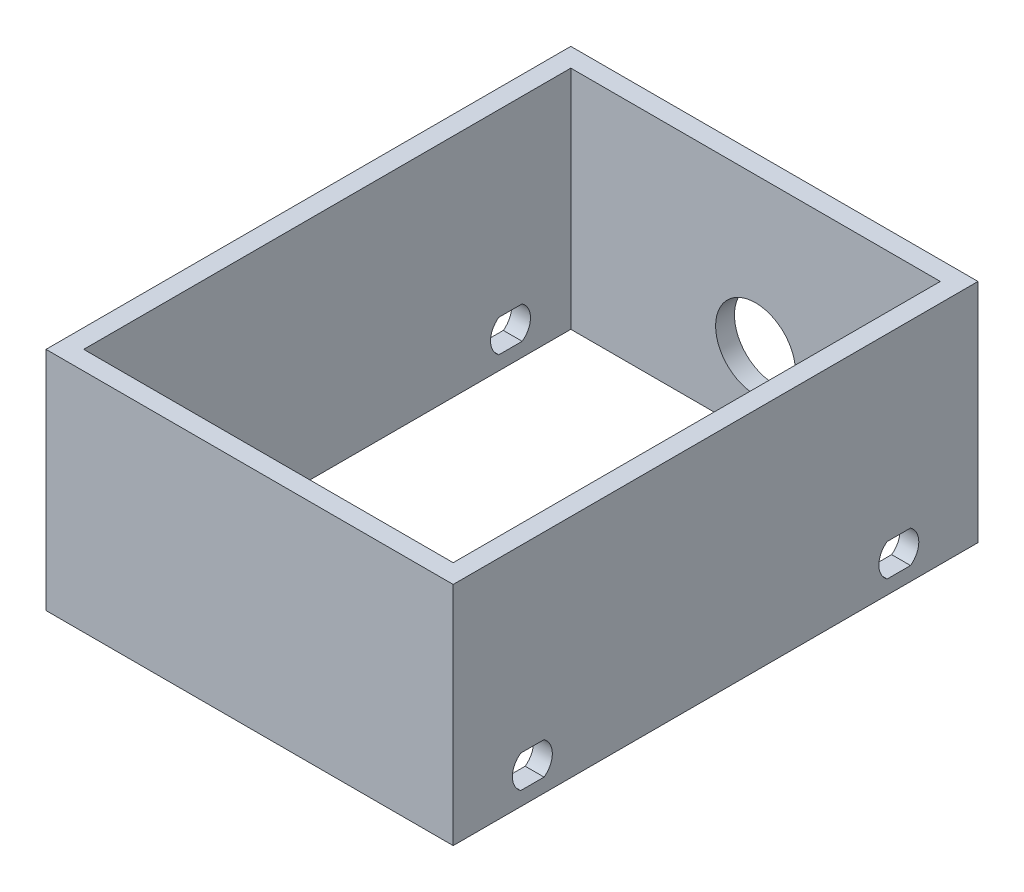
from build123d import *

# Parameters (mm, degrees)
BOSS_EXTRUDE1_DEPTH = 20
LOFT1_START         = -34.8
LOFT1_DEPTH         = 69.6
LOFT1_START_2       = -28
LOFT1_2_DEPTH       = 56
BOSS_EXTRUDE2_START = -2
BOSS_EXTRUDE2_DEPTH = 50
BOSS_EXTRUDE3_DEPTH = 2.3
BOSS_EXTRUDE4_DEPTH = 2.3
SKETCH9_W           = 56.929943861
SKETCH9_H           = 73.17042397
BOSS_EXTRUDE5_DEPTH = 34
SKETCH10_W          = 54
SKETCH10_H          = 69.6
SKETCH10_W_2        = 50
SKETCH10_H_2        = 65.6
BOSS_EXTRUDE6_DEPTH = 10
SKETCH11_W          = 50
SKETCH11_H          = 65.6
SKETCH11_W_2        = 49
SKETCH11_H_2        = 64.6
BOSS_EXTRUDE7_DEPTH = 30
CUT_EXTRUDE1_START  = -69.6
SKETCH7_R           = 5.3
CUT_EXTRUDE1_DEPTH  = 2.5
CUT_EXTRUDE2_DEPTH  = 70


with BuildPart() as part:
    # Sketch1 → Boss-Extrude1 (new body)
    with BuildSketch(Plane(origin=(0, 0, 0), x_dir=(1, 0, 0), z_dir=(0, 1, 0))):
        Polygon((27, 34.8), (-27, 34.8), (-27, 0), (-27, -34.8), (27, -34.8), (27, 0), align=None)
        Polygon((25, 0), (25, 32.8), (-25, 32.8), (-25, 0), (-25, -32.8), (25, -32.8), align=None, mode=Mode.SUBTRACT)
    extrude(amount=BOSS_EXTRUDE1_DEPTH)

    # Loft1: read off the stored shape, not the designer's step
    # Loft1 outline → Loft1 (add)
    with BuildSketch(Plane.XY.offset(LOFT1_START)):
        Polygon((-27, 20), (27, 20), (25, 35), (-25, 35), align=None)
    extrude(amount=LOFT1_DEPTH)

    # Loft1 2 outline → Loft1 2 (cut)
    with BuildSketch(Plane.YZ.offset(LOFT1_START_2)):
        Polygon((20, 34.8), (35, 32.8), (35, 34.8), align=None)
        Polygon((35, -32.8), (20, -34.8), (35, -34.8), align=None)
    extrude(amount=LOFT1_2_DEPTH, mode=Mode.SUBTRACT)

    # Cut-Loft1: read off the stored shape, not the designer's step
    # Cut-Loft1: loft between two sections, ruled curve by curve
    cut_loft1_from = [
        Edge.make_line((-25, 20, 32.8), (-25, 20, -32.8)),
        Edge.make_line((-25, 20, -32.8), (25, 20, -32.8)),
        Edge.make_line((25, 20, 32.8), (-25, 20, 32.8)),
        Edge.make_line((25, 20, -32.8), (25, 20, 32.8)),
    ]
    cut_loft1_to = [
        Edge.make_line((-23, 35, 30.8), (-23, 35, -30.8)),
        Edge.make_line((-23, 35, -30.8), (23, 35, -30.8)),
        Edge.make_line((23, 35, 30.8), (-23, 35, 30.8)),
        Edge.make_line((23, 35, -30.8), (23, 35, 30.8)),
    ]
    cut_loft1 = Solid(Shell([*[Face.make_surface_from_curves(cut_loft1_from[k], cut_loft1_to[k]) for k in range(4)], Face(Wire(cut_loft1_from)), Face(Wire(cut_loft1_to))]))
    add(cut_loft1, mode=Mode.SUBTRACT)

    # Sketch2 → Boss-Extrude2 (add)
    with BuildSketch(Plane(origin=(27, 0, 0), x_dir=(0, 0, -1), z_dir=(1, 0, 0)).offset(BOSS_EXTRUDE2_START)):
        with BuildLine():
            Line((32.8, 35), (32.8, 38.5))
            ThreePointArc((32.8, 38.5), (32.653553391, 38.853553391), (32.3, 39))
            Line((32.3, 39), (29.6, 39))
            ThreePointArc((29.6, 39), (29.246446609, 38.853553391), (29.1, 38.5))
            Line((29.1, 38.5), (29.1, 37.468550682))
            ThreePointArc((29.1, 37.468550682), (29.138060234, 37.277208966), (29.246446609, 37.114997291))
            Line((29.246446609, 37.114997291), (31.361443901, 35))
            Line((31.361443901, 35), (32.8, 35))
        make_face()
    extrude(amount=-BOSS_EXTRUDE2_DEPTH)


with BuildPart() as body_2:
    # Sketch5 → Boss-Extrude3 (new body)
    with BuildSketch(Plane.XZ):
        with BuildLine():
            Line((-25, -34.8), (-25, -9.8))
            ThreePointArc((-25, -9.8), (0, 15.2), (25, -9.8))
            Line((25, -9.8), (25, -34.8))
            Line((25, -34.8), (27, -34.8))
            Line((27, -34.8), (27, 34.8))
            Line((27, 34.8), (-27, 34.8))
            Line((-27, 34.8), (-27, -34.8))
            Line((-27, -34.8), (-25, -34.8))
        make_face()
    extrude(amount=BOSS_EXTRUDE3_DEPTH)

    # Sketch6 → Boss-Extrude4 (add)
    with BuildSketch(Plane.XZ.offset(2.3)):
        with BuildLine():
            Line((22.7, -34.8), (27, -34.8))
            Line((27, -34.8), (27, 34.8))
            Line((27, 34.8), (-27, 34.8))
            Line((-27, 34.8), (-27, -34.8))
            Line((-27, -34.8), (-22.7, -34.8))
            Line((-22.7, -34.8), (-22.7, -9.8))
            ThreePointArc((-22.7, -9.8), (0, 12.9), (22.7, -9.8))
            Line((22.7, -9.8), (22.7, -34.8))
        make_face()
    extrude(amount=BOSS_EXTRUDE4_DEPTH)


with BuildPart() as body_2_2:
    # Sketch9 → Boss-Extrude5 (new body)
    with BuildSketch(Plane(origin=(0, 20, 0), x_dir=(-1, 0, 0), z_dir=(0, 1, 0))):
        with Locations((0.264790437, -0.308922176)):
            Rectangle(SKETCH9_W, SKETCH9_H)
    extrude(amount=BOSS_EXTRUDE5_DEPTH)


with BuildPart() as part_1:
    add(part.part)

    # Combine1: cut body 2 2
    add(body_2_2.part, mode=Mode.SUBTRACT)

    # Sketch10 → Boss-Extrude6 (add)
    with BuildSketch(Plane(origin=(0, 20, 0), x_dir=(1, 0, 0), z_dir=(0, 1, 0))):
        Rectangle(SKETCH10_W, SKETCH10_H)
        Rectangle(SKETCH10_W_2, SKETCH10_H_2, mode=Mode.SUBTRACT)
    extrude(amount=BOSS_EXTRUDE6_DEPTH)

    # Sketch11 → Boss-Extrude7 (add)
    with BuildSketch(Plane(origin=(0, 30, 0), x_dir=(1, 0, 0), z_dir=(0, 1, 0))):
        Rectangle(SKETCH11_W, SKETCH11_H)
        Rectangle(SKETCH11_W_2, SKETCH11_H_2, mode=Mode.SUBTRACT)
    extrude(amount=-BOSS_EXTRUDE7_DEPTH)

    # Sketch7 → Cut-Extrude1 (cut)
    with BuildSketch(Plane.XY.offset(34.8).offset(CUT_EXTRUDE1_START)):
        with Locations((0, 10)):
            Circle(SKETCH7_R)
    extrude(amount=CUT_EXTRUDE1_DEPTH, mode=Mode.SUBTRACT)

    # Sketch8 → Cut-Extrude2 (cut)
    with BuildSketch(Plane.ZY.offset(27)):
        with BuildLine():
            Line((22.750806662, 6.15), (25.849193338, 6.15))
            ThreePointArc((25.849193338, 6.15), (26.95, 4), (25.849193338, 1.85))
            Line((25.849193338, 1.85), (22.750806662, 1.85))
            ThreePointArc((22.750806662, 1.85), (21.65, 4), (22.750806662, 6.15))
        make_face()
        with BuildLine():
            Line((-25.849193338, 6.15), (-22.750806662, 6.15))
            ThreePointArc((-22.750806662, 6.15), (-21.65, 4), (-22.750806662, 1.85))
            Line((-22.750806662, 1.85), (-25.849193338, 1.85))
            ThreePointArc((-25.849193338, 1.85), (-26.95, 4), (-25.849193338, 6.15))
        make_face()
    extrude(amount=-CUT_EXTRUDE2_DEPTH, mode=Mode.SUBTRACT)


solid = part_1.part
